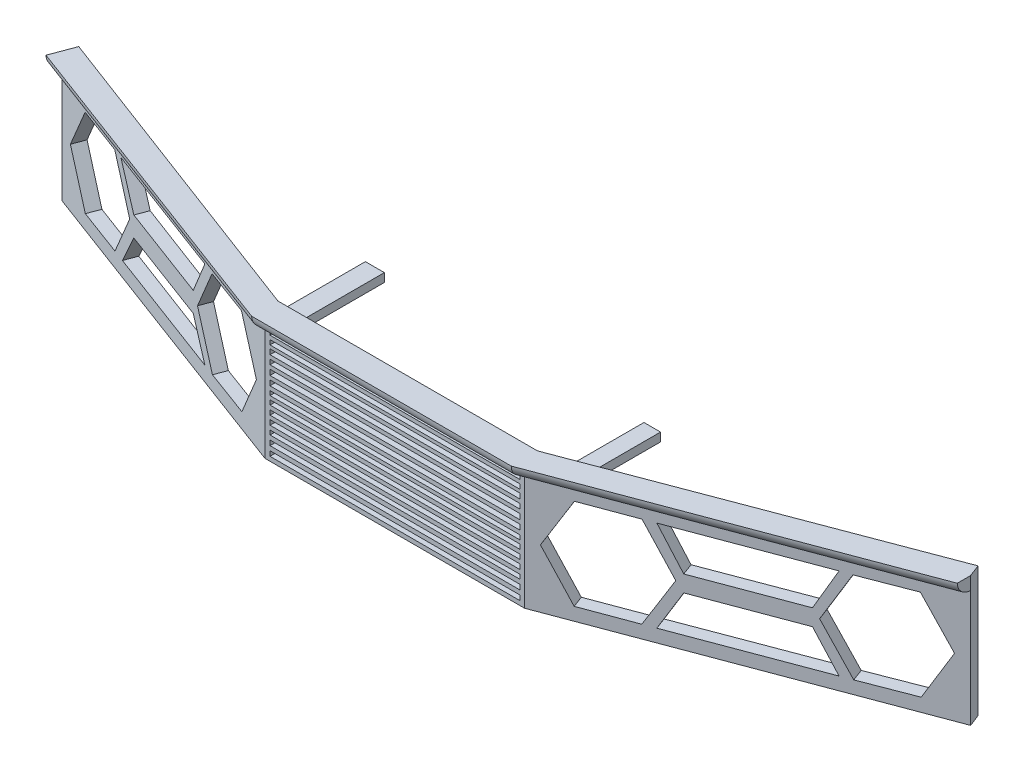
from build123d import *

# Parameters (mm, degrees)
BOSS_EXTRUDE1_DEPTH = 25.4
BOSS_EXTRUDE2_DEPTH = 2.54
FILLET1_R           = 2.54
SKETCH4_W           = 48.892470686
SKETCH4_H           = 0.953754561
SKETCH4_H_2         = 0.953754562
SKETCH4_H_3         = 0.853359345
SKETCH4_H_4         = 0.903556953
SKETCH4_H_5         = 0.853359344
SKETCH4_H_6         = 1.00395217
SKETCH4_H_7         = 1.054149779
CUT_EXTRUDE1_DEPTH  = 4.572
CUT_EXTRUDE2_DEPTH  = 4.572
CUT_EXTRUDE3_DEPTH  = 4.572
SKETCH7_W           = 3.24434763
SKETCH7_H           = 1.675925382
SKETCH7_W_2         = 3.718505185
BOSS_EXTRUDE3_DEPTH = 20.828


with BuildPart() as part:
    # Sketch1 → Boss-Extrude1 (new body)
    with BuildSketch(Plane(origin=(0, 0, 0), x_dir=(1, 0, 0), z_dir=(0, 1, 0))):
        Polygon((0, 0), (50.8, 0), (114.3, 23.790225691), (113.37882382, 26.157298661), (50.8, 2.54), (0, 2.54), (-62.608877976, 26.168775993), (-63.5, 23.790225691), align=None)
    extrude(amount=BOSS_EXTRUDE1_DEPTH)

    # Sketch3 → Boss-Extrude2 (add)
    with BuildSketch(Plane(origin=(0, 25.4, 0), x_dir=(1, 0, 0), z_dir=(0, 1, 0))):
        Polygon((-63.5, 23.790225691), (0, 0), (50.8, 0), (114.3, 23.790225691), (114.3, 21.184727317), (50.8, -2.605498375), (0, -2.605498375), (-64.355998278, 21.505426407), align=None)
    extrude(amount=-BOSS_EXTRUDE2_DEPTH)

    # Fillet1
    # the kernel refuses this fillet: 2.54 mm, written as the material it takes off along each edge
    with BuildSketch(Plane(origin=(5.946375755, 22.86, 4.833303434), x_dir=(0, 1, 0), z_dir=(-0.9364371267563882, 0, -0.35083544238323483))) as fillet1_piece_1_section:
        with BuildLine():
            CenterArc((FILLET1_R, FILLET1_R), FILLET1_R, 180, 90)
            Line((0, FILLET1_R), (0, 0))
            Line((0, 0), (FILLET1_R, 0))
        make_face()
    fillet1_piece_1 = extrude(amount=81.424313079, mode=Mode.PRIVATE)
    fillet1_piece_1 = split(fillet1_piece_1, bisect_by=Plane(origin=(0.305909805, 23.474834282, 0), z_dir=(0, 0, 1)), keep=Keep.TOP, mode=Mode.PRIVATE)
    fillet1_piece_1 = split(fillet1_piece_1, bisect_by=Plane(origin=(0.984368862, 23.474834282, 0.36879303), z_dir=(-0.35083544238323505, 0, 0.9364371267563881)), keep=Keep.TOP, mode=Mode.PRIVATE)
    add(fillet1_piece_1, mode=Mode.SUBTRACT)
    with BuildSketch(Plane(origin=(5.946375755, 22.86, 4.833303434), x_dir=(0, 1, 0), z_dir=(-0.9364371267563882, 0, -0.35083544238323483))) as fillet1_piece_2_section:
        with BuildLine():
            CenterArc((FILLET1_R, FILLET1_R), FILLET1_R, 180, 90)
            Line((0, FILLET1_R), (0, 0))
            Line((0, 0), (FILLET1_R, 0))
        make_face()
    fillet1_piece_2 = extrude(amount=81.424313079, mode=Mode.PRIVATE)
    fillet1_piece_2 = split(fillet1_piece_2, bisect_by=Plane(origin=(3.480294326, 22.834935374, 0), z_dir=(0, 0, 1)), keep=Keep.TOP, mode=Mode.PRIVATE)
    fillet1_piece_2 = split(fillet1_piece_2, bisect_by=Plane(origin=(3.46295466, 22.834935374, 1.297393274), z_dir=(0.35083544238323505, 0, -0.9364371267563881)), keep=Keep.TOP, mode=Mode.PRIVATE)
    add(fillet1_piece_2, mode=Mode.SUBTRACT)
    with BuildSketch(Plane(origin=(5.946375755, 22.86, 4.833303434), x_dir=(0, 1, 0), z_dir=(-0.9364371267563882, 0, -0.35083544238323483))) as fillet1_piece_3_section:
        with BuildLine():
            CenterArc((FILLET1_R, FILLET1_R), FILLET1_R, 180, 90)
            Line((0, FILLET1_R), (0, 0))
            Line((0, 0), (FILLET1_R, 0))
        make_face()
    fillet1_piece_3 = extrude(amount=81.424313079, mode=Mode.PRIVATE)
    fillet1_piece_3 = split(fillet1_piece_3, bisect_by=Plane(origin=(-37.699790788, 23.430211039, 0), z_dir=(0, 0, -1)), keep=Keep.TOP, mode=Mode.PRIVATE)
    fillet1_piece_3 = split(fillet1_piece_3, bisect_by=Plane(origin=(-37.047344153, 23.430211039, -13.879758719), z_dir=(-0.35083544238323505, 0, 0.9364371267563881)), keep=Keep.TOP, mode=Mode.PRIVATE)
    add(fillet1_piece_3, mode=Mode.SUBTRACT)
    with BuildSketch(Plane(origin=(57.15, 22.86, 2.605498375), x_dir=(0, 1, 0), z_dir=(-1, 0, 0))) as fillet1_piece_4:
        with BuildLine():
            CenterArc((FILLET1_R, FILLET1_R), FILLET1_R, 180, 90)
            Line((0, FILLET1_R), (0, 0))
            Line((0, 0), (FILLET1_R, 0))
        make_face()
    extrude(amount=63.5, mode=Mode.SUBTRACT)
    with BuildSketch(Plane(origin=(120.246375755, 22.86, -23.412532376), x_dir=(0, 1, 0), z_dir=(-0.9364371267563881, 0, 0.3508354423832351))) as fillet1_piece_5_section:
        with BuildLine():
            CenterArc((FILLET1_R, FILLET1_R), FILLET1_R, 180, 90)
            Line((0, FILLET1_R), (0, 0))
            Line((0, 0), (FILLET1_R, 0))
        make_face()
    fillet1_piece_5 = extrude(amount=80.510211904, mode=Mode.PRIVATE)
    fillet1_piece_5 = split(fillet1_piece_5, bisect_by=Plane(origin=(88.071552379, 23.43012107, 0), z_dir=(0, 0, -1)), keep=Keep.TOP, mode=Mode.PRIVATE)
    fillet1_piece_5 = split(fillet1_piece_5, bisect_by=Plane(origin=(87.41915819, 23.43012107, -13.719339181), z_dir=(0.35083544238323505, 0, 0.9364371267563881)), keep=Keep.TOP, mode=Mode.PRIVATE)
    add(fillet1_piece_5, mode=Mode.SUBTRACT)
    with BuildSketch(Plane(origin=(120.246375755, 22.86, -23.412532376), x_dir=(0, 1, 0), z_dir=(-0.9364371267563881, 0, 0.3508354423832351))) as fillet1_piece_6_section:
        with BuildLine():
            CenterArc((FILLET1_R, FILLET1_R), FILLET1_R, 180, 90)
            Line((0, FILLET1_R), (0, 0))
            Line((0, 0), (FILLET1_R, 0))
        make_face()
    fillet1_piece_6 = extrude(amount=80.510211904, mode=Mode.PRIVATE)
    fillet1_piece_6 = split(fillet1_piece_6, bisect_by=Plane(origin=(50.494090195, 23.474834282, 0), z_dir=(0, 0, 1)), keep=Keep.TOP, mode=Mode.PRIVATE)
    fillet1_piece_6 = split(fillet1_piece_6, bisect_by=Plane(origin=(49.815631138, 23.474834282, 0.36879303), z_dir=(0.35083544238323505, 0, 0.9364371267563881)), keep=Keep.TOP, mode=Mode.PRIVATE)
    add(fillet1_piece_6, mode=Mode.SUBTRACT)
    with BuildSketch(Plane(origin=(120.246375755, 22.86, -23.412532376), x_dir=(0, 1, 0), z_dir=(-0.9364371267563881, 0, 0.3508354423832351))) as fillet1_piece_7_section:
        with BuildLine():
            CenterArc((FILLET1_R, FILLET1_R), FILLET1_R, 180, 90)
            Line((0, FILLET1_R), (0, 0))
            Line((0, 0), (FILLET1_R, 0))
        make_face()
    fillet1_piece_7 = extrude(amount=80.510211904, mode=Mode.PRIVATE)
    fillet1_piece_7 = split(fillet1_piece_7, bisect_by=Plane(origin=(47.319705674, 22.834935374, 0), z_dir=(0, 0, 1)), keep=Keep.TOP, mode=Mode.PRIVATE)
    fillet1_piece_7 = split(fillet1_piece_7, bisect_by=Plane(origin=(47.33704534, 22.834935374, 1.297393274), z_dir=(-0.35083544238323505, 0, -0.9364371267563881)), keep=Keep.TOP, mode=Mode.PRIVATE)
    add(fillet1_piece_7, mode=Mode.SUBTRACT)

    # Sketch4 → Cut-Extrude1 (cut)
    with BuildSketch(Plane.XY):
        with Locations((25.43082689, 1.319550291)):
            Rectangle(SKETCH4_W, SKETCH4_H)
        with Locations((25.43082689, 3.126664197)):
            Rectangle(SKETCH4_W, SKETCH4_H_2)
        with Locations((25.43082689, 4.883580495)):
            Rectangle(SKETCH4_W, SKETCH4_H_3)
        with Locations((25.43082689, 6.590299184)):
            Rectangle(SKETCH4_W, SKETCH4_H_2)
        with Locations((25.43082689, 8.271919069)):
            Rectangle(SKETCH4_W, SKETCH4_H_4)
        with Locations((25.43082689, 9.978637758)):
            Rectangle(SKETCH4_W, SKETCH4_H_4)
        with Locations((25.43082689, 11.559862426)):
            Rectangle(SKETCH4_W, SKETCH4_H_5)
        with Locations((25.43082689, 13.29167992)):
            Rectangle(SKETCH4_W, SKETCH4_H_6)
        with Locations((25.43082689, 15.073695022)):
            Rectangle(SKETCH4_W, SKETCH4_H_7)
        with Locations((25.43082689, 16.83061132)):
            Rectangle(SKETCH4_W, SKETCH4_H)
        with Locations((25.43082689, 18.562428813)):
            Rectangle(SKETCH4_W, SKETCH4_H_6)
        with Locations((25.43082689, 20.168752286)):
            Rectangle(SKETCH4_W, SKETCH4_H_4)
        with Locations((25.43082689, 21.800174562)):
            Rectangle(SKETCH4_W, SKETCH4_H_3)
    extrude(amount=-CUT_EXTRUDE1_DEPTH, mode=Mode.SUBTRACT)

    # Sketch5 → Cut-Extrude2 (cut)
    with BuildSketch(Plane(origin=(6.252743788, 0, 16.689594948), x_dir=(0.9364371267563881, 0, -0.35083544238323516), z_dir=(0.35083544238323516, 0, 0.9364371267563881))):
        Polygon((95.385492335, 2.513306314), (91.342188498, 9.687056546), (71.771776783, 9.687056546), (67.681786758, 2.513306314), align=None)
        Polygon((107.872330044, 2.586895642), (112.935981689, 11.50457622), (107.744869589, 20.34866747), (97.490105842, 20.275078142), (92.426454197, 11.357397564), (97.617566297, 2.513306314), align=None)
        Polygon((65.396301526, 2.513306314), (70.556591706, 11.410782697), (65.431296219, 20.328463275), (55.145710553, 20.34866747), (49.985420372, 11.451191088), (55.110715859, 2.53351051), align=None)
        Polygon((91.342188498, 12.895099362), (71.771776783, 12.895099362), (67.681786758, 20.328463275), (95.385492335, 20.328463275), align=None)
    extrude(amount=-CUT_EXTRUDE2_DEPTH, mode=Mode.SUBTRACT)

    # Sketch6 → Cut-Extrude3 (cut)
    with BuildSketch(Plane(origin=(0, 0, 0), x_dir=(0.9364371267563881, 0, 0.35083544238323516), z_dir=(-0.35083544238323516, 0, 0.9364371267563881))):
        Polygon((-20.081392491, 2.871915117), (-47.639225338, 2.871915117), (-43.82197308, 9.151723276), (-23.965625147, 9.151723276), align=None)
        Polygon((-7.714681248, 2.947668713), (-2.860571572, 11.506740488), (-7.845890325, 19.990058667), (-17.685318752, 19.914305072), (-22.539428428, 11.355233297), (-17.554109675, 2.871915117), align=None)
        Polygon((-50.125492855, 2.871915117), (-45.20547879, 11.468344332), (-50.190197838, 20.027416107), (-60.094930953, 19.990058667), (-65.014945018, 11.393629453), (-60.030225969, 2.834557678), align=None)
        Polygon((-23.965625147, 13.042600451), (-43.82197308, 13.042600451), (-48.142272105, 20.027416107), (-20.081392491, 20.027416107), align=None)
    extrude(amount=-CUT_EXTRUDE3_DEPTH, mode=Mode.SUBTRACT)

    # Sketch7 → Boss-Extrude3 (add)
    with BuildSketch(Plane(origin=(0, 0, -2.54), x_dir=(-1, 0, 0), z_dir=(0, 0, -1))):
        with Locations((-52.422173815, 18.963924101)):
            Rectangle(SKETCH7_W, SKETCH7_H)
        with Locations((1.859252593, 18.963924101)):
            Rectangle(SKETCH7_W_2, SKETCH7_H)
    extrude(amount=BOSS_EXTRUDE3_DEPTH)


solid = part.part
